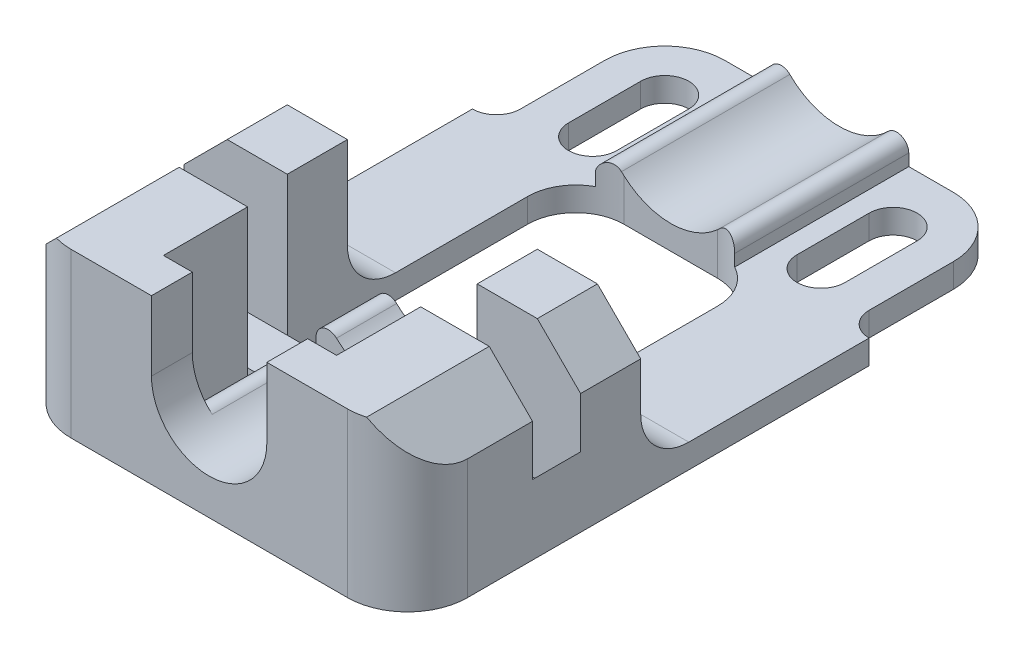
from build123d import *

# Parameters (mm, degrees)
SKETCH1_W           = 16.5
SKETCH1_H           = 9.7
BOSS_EXTRUDE1_DEPTH = 6.8
SKETCH2_W           = 16.5
SKETCH2_H           = 2
CUT_EXTRUDE1_DEPTH  = 5.8
CUT_EXTRUDE2_REACH  = 16.436
SKETCH3_R           = 2.75
CUT_EXTRUDE3_REACH  = 16.436
SKETCH4_R           = 2.4
SKETCH4_W           = 4.8
SKETCH4_H           = 2.9
SKETCH5_W           = 1.2
SKETCH5_H           = 2.5
SKETCH5_H_2         = 3.5
CUT_EXTRUDE4_DEPTH  = 12.739889267
BOSS_EXTRUDE2_DEPTH = 2
CHAMFER1_SIZE       = 1.8
FILLET4_R           = 2.5
SKETCH8_W           = 2.5
SKETCH8_H           = 9.5
SKETCH8_W_2         = 1.8
BOSS_EXTRUDE3_DEPTH = 1
BOSS_EXTRUDE5_DEPTH = 7
FILLET1_START       = -22
FILLET1_DEPTH       = 25.15
FILLET1_2_DEPTH     = 7.65
FILLET1_START_2     = -14.35
FILLET1_3_DEPTH     = 12
FILLET1_START_3     = -0.35
FILLET1_4_DEPTH     = 3.5
FILLET5_R           = 2


with BuildPart() as part:
    # Sketch1 → Boss-Extrude1 (new body)
    with BuildSketch(Plane(origin=(0, 0, 0), x_dir=(1, 0, 0), z_dir=(0, 1, 0))):
        Rectangle(SKETCH1_W, SKETCH1_H)
    extrude(amount=BOSS_EXTRUDE1_DEPTH)

    # Sketch2 → Cut-Extrude1 (cut)
    with BuildSketch(Plane(origin=(0, 6.8, 0), x_dir=(1, 0, 0), z_dir=(0, 1, 0))):
        with Locations((0, 1.35)):
            Rectangle(SKETCH2_W, SKETCH2_H)
    extrude(amount=-CUT_EXTRUDE1_DEPTH, mode=Mode.SUBTRACT)

    # Sketch3 → Cut-Extrude2 (cut, up to next)
    with BuildSketch(Plane(origin=(0, 0, -4.85), x_dir=(-1, 0, 0), z_dir=(0, 0, -1)), mode=Mode.PRIVATE) as cut_extrude2_sk1:
        with Locations((0, 3.9)):
            Circle(SKETCH3_R)
    cut_extrude2_tool1 = extrude(cut_extrude2_sk1.sketch, amount=-CUT_EXTRUDE2_REACH, mode=Mode.PRIVATE) & part.part
    # Sketch3 → Cut-Extrude2 (cut, up to next)
    with BuildSketch(Plane(origin=(0, 0, -4.85), x_dir=(-1, 0, 0), z_dir=(0, 0, -1)), mode=Mode.PRIVATE) as cut_extrude2_sk2:
        with BuildLine():
            Line((-2.75, 6.8), (-2.75, 3.9))
            ThreePointArc((-2.75, 3.9), (0, 6.65), (2.75, 3.9))
            Line((2.75, 3.9), (2.75, 6.8))
            Line((2.75, 6.8), (-2.75, 6.8))
        make_face()
    cut_extrude2_tool2 = extrude(cut_extrude2_sk2.sketch, amount=-CUT_EXTRUDE2_REACH, mode=Mode.PRIVATE) & part.part
    add(cut_extrude2_tool1.solids().sort_by_distance((0, 3.9, -4.85))[0], mode=Mode.SUBTRACT)
    add(cut_extrude2_tool2.solids().sort_by_distance((2.687823, 5.35, -4.85))[0], mode=Mode.SUBTRACT)

    # Sketch4 → Cut-Extrude3 (cut, up to next)
    with BuildSketch(Plane.XY.offset(4.85), mode=Mode.PRIVATE) as cut_extrude3_sk1:
        with Locations((0, 3.9)):
            Circle(SKETCH4_R)
    cut_extrude3_tool1 = extrude(cut_extrude3_sk1.sketch, amount=-CUT_EXTRUDE3_REACH, mode=Mode.PRIVATE) & part.part
    # Sketch4 → Cut-Extrude3 (cut, up to next)
    with BuildSketch(Plane.XY.offset(4.85), mode=Mode.PRIVATE) as cut_extrude3_sk2:
        with Locations((0, 5.35)):
            Rectangle(SKETCH4_W, SKETCH4_H)
    cut_extrude3_tool2 = extrude(cut_extrude3_sk2.sketch, amount=-CUT_EXTRUDE3_REACH, mode=Mode.PRIVATE) & part.part
    add(cut_extrude3_tool1.solids().sort_by_distance((0, 3.9, 4.85))[0], mode=Mode.SUBTRACT)
    add(cut_extrude3_tool2.solids().sort_by_distance((0, 5.35, 4.85))[0], mode=Mode.SUBTRACT)

    # Sketch5 → Cut-Extrude4 (cut, through all)
    with BuildSketch(Plane(origin=(0, 6.8, 0), x_dir=(1, 0, 0), z_dir=(0, 1, 0))):
        with Locations((-3.35, 3.6)):
            Rectangle(SKETCH5_W, SKETCH5_H)
        with Locations((3.35, 3.6)):
            Rectangle(SKETCH5_W, SKETCH5_H)
        with Locations((-3, -1.4)):
            Rectangle(SKETCH5_W, SKETCH5_H_2)
        with Locations((3, -1.4)):
            Rectangle(SKETCH5_W, SKETCH5_H_2)
    extrude(amount=-CUT_EXTRUDE4_DEPTH, mode=Mode.SUBTRACT)

    # Sketch7 → Boss-Extrude2 (add)
    with BuildSketch(Plane.XY.offset(-2.35)):
        Polygon((-6.35, 1), (-8.25, 2.9), (-8.25, 1), align=None)
        Polygon((8.25, 2.9), (8.25, 1), (6.35, 1), align=None)
    extrude(amount=BOSS_EXTRUDE2_DEPTH)

    # Chamfer1
    chamfer1_edges = [part.edges().sort_by_distance(p)[0] for p in [
        (-8.25, 6.8, -3.6),
        (8.25, 6.8, -3.6),
        (-8.25, 6.8, 2.25),
        (8.25, 6.8, 2.25),
    ]]
    chamfer(chamfer1_edges, length=CHAMFER1_SIZE)

    # Fillet4
    fillet4_edges = [part.edges().sort_by_distance(p)[0] for p in [
        (8.25, 2.5, 4.85),
        (-8.25, 2.5, 4.85),
    ]]
    fillet(fillet4_edges, radius=FILLET4_R)

    # Sketch8 → Boss-Extrude3 (add)
    # profile 1 of 7: a face of its own
    with BuildSketch(Plane.XZ):
        with Locations((-7, -9.6)):
            Rectangle(SKETCH8_W, SKETCH8_H)
    # profile 2 of 7: a face of its own
    with BuildSketch(Plane.XZ):
        with Locations((7, -9.6)):
            Rectangle(SKETCH8_W, SKETCH8_H)
    # profile 3 of 7: a face of its own
    with BuildSketch(Plane.XZ):
        with BuildLine():
            Line((8.25, -14.35), (5.75, -14.35))
            Line((5.75, -14.35), (5.75, -15.85))
            Line((5.75, -15.85), (7.25, -15.85))
            Line((7.25, -15.85), (7.25, -15.35))
            ThreePointArc((7.25, -15.35), (7.542893219, -14.642893219), (8.25, -14.35))
        make_face()
    # profile 4 of 7: a face of its own
    with BuildSketch(Plane.XZ):
        with BuildLine():
            Line((-7.25, -15.85), (-5.75, -15.85))
            Line((-5.75, -15.85), (-5.75, -14.35))
            Line((-5.75, -14.35), (-8.25, -14.35))
            ThreePointArc((-8.25, -14.35), (-7.542893219, -14.642893219), (-7.25, -15.35))
            Line((-7.25, -15.35), (-7.25, -15.85))
        make_face()
    # profile 5 of 7: a face of its own
    with BuildSketch(Plane.XZ):
        with BuildLine():
            Line((-5.75, -14.35), (-5.75, -15.85))
            Line((-5.75, -15.85), (-7.25, -15.85))
            Line((-7.25, -15.85), (-7.25, -18.85))
            ThreePointArc((-7.25, -18.85), (-6.517766953, -20.617766953), (-4.75, -21.35))
            Line((-4.75, -21.35), (4.75, -21.35))
            ThreePointArc((4.75, -21.35), (6.517766953, -20.617766953), (7.25, -18.85))
            Line((7.25, -18.85), (7.25, -15.85))
            Line((7.25, -15.85), (5.75, -15.85))
            Line((5.75, -15.85), (5.75, -14.35))
            Line((5.75, -14.35), (3.95, -14.35))
            Line((3.95, -14.35), (-3.95, -14.35))
            Line((-3.95, -14.35), (-5.75, -14.35))
        make_face()
        with BuildLine():
            ThreePointArc((-3.75, -18.85), (-4.75, -19.85), (-5.75, -18.85))
            Line((-5.75, -18.85), (-5.75, -15.85))
            ThreePointArc((-5.75, -15.85), (-4.75, -14.85), (-3.75, -15.85))
            Line((-3.75, -15.85), (-3.75, -18.85))
        make_face(mode=Mode.SUBTRACT)
        with BuildLine():
            ThreePointArc((3.75, -15.85), (4.75, -14.85), (5.75, -15.85))
            Line((5.75, -15.85), (5.75, -18.85))
            ThreePointArc((5.75, -18.85), (4.75, -19.85), (3.75, -18.85))
            Line((3.75, -18.85), (3.75, -15.85))
        make_face(mode=Mode.SUBTRACT)
    # profile 6 of 7: a face of its own
    with BuildSketch(Plane.XZ):
        with Locations((-4.85, -9.6)):
            Rectangle(SKETCH8_W_2, SKETCH8_H)
    # profile 7 of 7: a face of its own
    with BuildSketch(Plane.XZ):
        with Locations((4.85, -9.6)):
            Rectangle(SKETCH8_W_2, SKETCH8_H)
    extrude(amount=-BOSS_EXTRUDE3_DEPTH)

    # Sketch11 → Boss-Extrude5 (add)
    with BuildSketch(Plane(origin=(0, 0, -21.35), x_dir=(-1, 0, 0), z_dir=(0, 0, -1))):
        with BuildLine():
            Line((2.9, 1), (2.9, 3.9))
            ThreePointArc((2.9, 3.9), (2.050609665, 1.849390335), (0, 1))
            Line((0, 1), (2.9, 1))
        make_face()
        with BuildLine():
            ThreePointArc((0, 1), (-2.050609665, 1.849390335), (-2.9, 3.9))
            Line((-2.9, 3.9), (-2.9, 1))
            Line((-2.9, 1), (0, 1))
        make_face()
    extrude(amount=-BOSS_EXTRUDE5_DEPTH)

    # Fillet1: read off the stored shape, not the designer's step
    # Fillet1 outline → Fillet1 (cut)
    with BuildSketch(Plane.XY.offset(FILLET1_START)):
        with BuildLine():
            Line((-2.9, 3.9), (-2.9, 1.491681084))
            ThreePointArc((-2.9, 1.491681084), (-2.792530688, 1.801390075), (-2.516321365, 1.977962217))
            ThreePointArc((-2.516321365, 1.977962217), (-2.394047935, 2.033592906), (-2.261376801, 2.054662672))
            ThreePointArc((-2.261376801, 2.054662672), (-1.923333419, 2.208565025), (-1.572413793, 2.086849465))
            ThreePointArc((-1.572413793, 2.086849465), (-2.183322366, 2.903454242), (-2.4, 3.9))
            Line((-2.4, 3.9), (-2.4, 2.557427842))
            ThreePointArc((-2.4, 2.557427842), (-2.661061818, 3.206278154), (-2.75, 3.9))
            Line((-2.75, 3.9), (-2.75, 2.979402368))
            ThreePointArc((-2.75, 2.979402368), (-2.862254356, 3.433631047), (-2.9, 3.9))
        make_face()
        with BuildLine():
            ThreePointArc((2.4, 3.9), (2.183322366, 2.903454242), (1.572413793, 2.086849465))
            ThreePointArc((1.572413793, 2.086849465), (1.923333419, 2.208565025), (2.261376801, 2.054662672))
            ThreePointArc((2.261376801, 2.054662672), (2.394047935, 2.033592906), (2.516321365, 1.977962217))
            ThreePointArc((2.516321365, 1.977962217), (2.792530688, 1.801390075), (2.9, 1.491681084))
            Line((2.9, 1.491681084), (2.9, 3.9))
            ThreePointArc((2.9, 3.9), (2.862254356, 3.433631047), (2.75, 2.979402368))
            Line((2.75, 2.979402368), (2.75, 3.9))
            ThreePointArc((2.75, 3.9), (2.661061818, 3.206278154), (2.4, 2.557427842))
            Line((2.4, 2.557427842), (2.4, 3.9))
        make_face()
    extrude(amount=FILLET1_DEPTH, mode=Mode.SUBTRACT)

    # Fillet1 2 outline → Fillet1 2 (cut)
    with BuildSketch(Plane.XY.offset(FILLET1_START)):
        with BuildLine():
            ThreePointArc((-2.516321365, 1.977962217), (-2.264497484, 1.97297005), (-2.047058824, 1.845845631))
            ThreePointArc((-2.047058824, 1.845845631), (-2.150447744, 1.954344712), (-2.248093276, 2.068040224))
            ThreePointArc((-2.248093276, 2.068040224), (-2.254798094, 2.06141406), (-2.261376801, 2.054662672))
            ThreePointArc((-2.261376801, 2.054662672), (-2.394047935, 2.033592906), (-2.516321365, 1.977962217))
        make_face()
        with BuildLine():
            ThreePointArc((2.047058824, 1.845845631), (2.264497484, 1.97297005), (2.516321365, 1.977962217))
            ThreePointArc((2.516321365, 1.977962217), (2.394047935, 2.033592906), (2.261376801, 2.054662672))
            ThreePointArc((2.261376801, 2.054662672), (2.254798094, 2.06141406), (2.248093276, 2.068040224))
            ThreePointArc((2.248093276, 2.068040224), (2.150447744, 1.954344712), (2.047058824, 1.845845631))
        make_face()
    extrude(amount=FILLET1_2_DEPTH, mode=Mode.SUBTRACT)

    # Fillet1 3 outline → Fillet1 3 (cut)
    with BuildSketch(Plane.XY.offset(FILLET1_START_2)):
        with BuildLine():
            ThreePointArc((-2.516321365, 1.977962217), (-2.641945637, 1.929245147), (-2.75, 1.848752506))
            Line((-2.75, 1.848752506), (-2.75, 1.55479212))
            ThreePointArc((-2.75, 1.55479212), (-2.687698916, 1.796493711), (-2.516321365, 1.977962217))
        make_face()
        with BuildLine():
            ThreePointArc((-2.261376801, 2.054662672), (-2.068743309, 2.020781403), (-1.903846154, 1.915593332))
            ThreePointArc((-1.903846154, 1.915593332), (-2.01831936, 2.032143753), (-2.125669903, 2.155285851))
            ThreePointArc((-2.125669903, 2.155285851), (-2.197803986, 2.1107474), (-2.261376801, 2.054662672))
        make_face()
        with BuildLine():
            ThreePointArc((2.261376801, 2.054662672), (2.197803986, 2.1107474), (2.125669903, 2.155285851))
            ThreePointArc((2.125669903, 2.155285851), (2.01831936, 2.032143753), (1.903846154, 1.915593332))
            ThreePointArc((1.903846154, 1.915593332), (2.068743309, 2.020781403), (2.261376801, 2.054662672))
        make_face()
        with BuildLine():
            ThreePointArc((2.75, 1.848752506), (2.641945637, 1.929245147), (2.516321365, 1.977962217))
            ThreePointArc((2.516321365, 1.977962217), (2.687698916, 1.796493711), (2.75, 1.55479212))
            Line((2.75, 1.55479212), (2.75, 1.848752506))
        make_face()
    extrude(amount=FILLET1_3_DEPTH, mode=Mode.SUBTRACT)

    # Fillet1 4 outline → Fillet1 4 (cut)
    with BuildSketch(Plane.XY.offset(FILLET1_START_3)):
        with BuildLine():
            Line((-2.4, 2.031761721), (-2.4, 1.70910977))
            ThreePointArc((-2.4, 1.70910977), (-2.364051937, 1.895270453), (-2.261376801, 2.054662672))
            ThreePointArc((-2.261376801, 2.054662672), (-2.331496818, 2.048105681), (-2.4, 2.031761721))
        make_face()
        with BuildLine():
            ThreePointArc((2.261376801, 2.054662672), (2.364051937, 1.895270453), (2.4, 1.70910977))
            Line((2.4, 1.70910977), (2.4, 2.031761721))
            ThreePointArc((2.4, 2.031761721), (2.331496818, 2.048105681), (2.261376801, 2.054662672))
        make_face()
    extrude(amount=FILLET1_4_DEPTH, mode=Mode.SUBTRACT)

    # Fillet5
    fillet5_edges = [part.edges().sort_by_distance(p)[0] for p in [
        (-3.95, 0.5, -14.35),
        (3.95, 0.5, -14.35),
        (6.1, 1, -4.85),
        (-6.1, 1, -4.85),
    ]]
    fillet(fillet5_edges, radius=FILLET5_R)


solid = part.part
